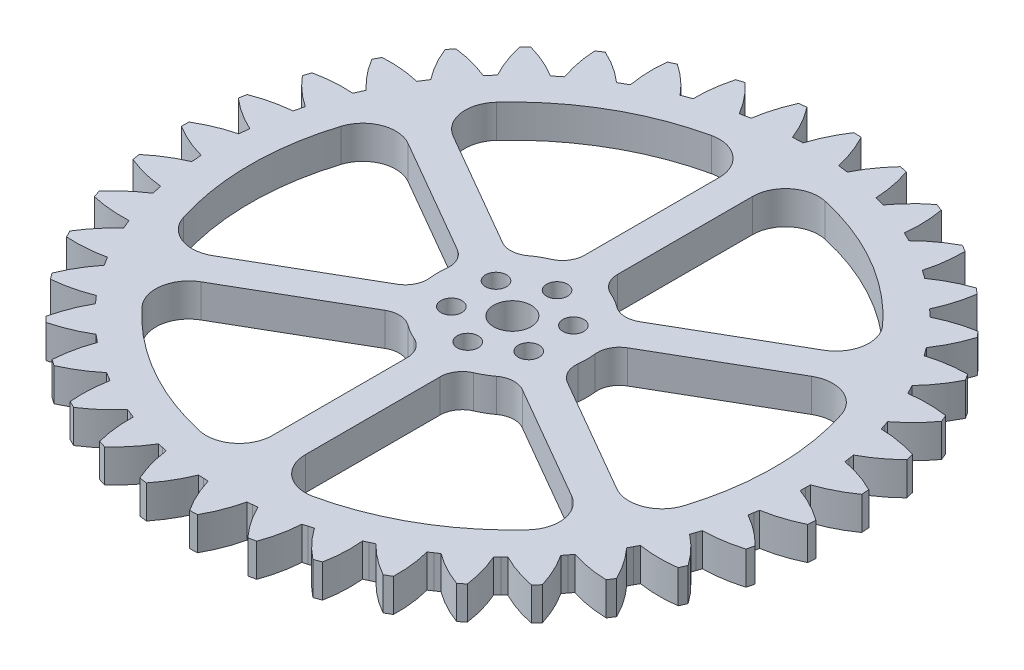
from build123d import *

# Parameters (mm, degrees)
BOSS_EXTRUDE1_DEPTH      = 1.5
CIRPATTERN2_COUNT        = 39
SKETCH3_R                = 0.95
SKETCH3_R_2              = 1.7
CUT_EXTRUDE1_DEPTH       = 43.388110201
CUT_EXTRUDE2_DEPTH       = 43.388110201
FILLET1_R                = 3
FILLET2_R                = 2
CIRPATTERN1_COUNT        = 6
FILLET1_OF_CIRPATTERN1_R = 3
FILLET2_OF_CIRPATTERN1_R = 2


with BuildPart() as part:
    # Sketch5 → Boss-Extrude1 (new, symmetric)
    with BuildSketch(Plane(origin=(0, 0, 0), x_dir=(1, 0, 0), z_dir=(0, 1, 0))):
        with BuildLine():
            Line((29.794725899, 2.521076439), (29.819813733, 2.177516055))
            Line((29.819813733, 2.177516055), (29.844901148, 1.833955641))
            ThreePointArc((29.844901148, 1.833955641), (28.363282087, 0.932985765), (26.768092937, 0.253049491))
            Line((26.768092937, 0.253049491), (26.763647744, -0.205029062))
            Line((26.763647744, -0.205029062), (0, 0))
            Line((0, 0), (26.449954509, 4.090817025))
            Line((26.449954509, 4.090817025), (26.520897753, 3.638243521))
            ThreePointArc((26.520897753, 3.638243521), (28.197939687, 3.197253599), (29.794725899, 2.521076439))
        make_face()
    boss_extrude1 = extrude(amount=BOSS_EXTRUDE1_DEPTH, both=True)

    # CirPattern2: Boss-Extrude1 ×39 about axis
    cirpattern2_axis = Axis((0, -1.5, 0), (0, 1, 0))
    for i in range(1, CIRPATTERN2_COUNT):
        add(boss_extrude1.rotate(cirpattern2_axis, i * 360 / CIRPATTERN2_COUNT))

    # Sketch3 → Cut-Extrude1 (cut, through all)
    with BuildSketch(Plane(origin=(0, 1.5, 0), x_dir=(1, 0, 0), z_dir=(0, 1, 0))):
        with Locations((-3.507402885, 2.025)):
            Circle(SKETCH3_R)
        with Locations((-3.507402885, -2.025)):
            Circle(SKETCH3_R)
        with Locations((0, -4.05)):
            Circle(SKETCH3_R)
        with Locations((3.507402885, -2.025)):
            Circle(SKETCH3_R)
        with Locations((3.507402885, 2.025)):
            Circle(SKETCH3_R)
        with Locations((0, 4.05)):
            Circle(SKETCH3_R)
        Circle(SKETCH3_R_2)
    extrude(amount=-CUT_EXTRUDE1_DEPTH, mode=Mode.SUBTRACT)

    # Sketch4 → Cut-Extrude2 (cut, through all)
    with BuildSketch(Plane(origin=(0, 1.5, 0), x_dir=(1, 0, 0), z_dir=(0, 1, 0))):
        with BuildLine():
            Line((6.470380585, 2.003625165), (21.289565422, 10.55948552))
            ThreePointArc((21.289565422, 10.55948552), (23.764434147, 0), (21.289565422, -10.55948552))
            Line((21.289565422, -10.55948552), (6.470380585, -2.003625165))
            ThreePointArc((6.470380585, -2.003625165), (6.773502692, 0), (6.470380585, 2.003625165))
        make_face()
    cut_extrude2 = extrude(amount=-CUT_EXTRUDE2_DEPTH, mode=Mode.SUBTRACT)

    # Fillet1
    fillet1_edges = [part.edges().sort_by_distance(p)[0] for p in [
        (21.289565422, 0, 10.55948552),
        (21.289565422, 0, -10.55948552),
    ]]
    fillet(fillet1_edges, radius=FILLET1_R)

    # Fillet2
    fillet2_edges = [part.edges().sort_by_distance(p)[0] for p in [
        (6.470380585, 0, 2.003625165),
        (6.470380585, 0, -2.003625165),
    ]]
    fillet(fillet2_edges, radius=FILLET2_R)

    # CirPattern1: Cut-Extrude2 ×6 about axis
    cirpattern1_axis = Axis((0, -1.5, 0), (0, 1, 0))
    for i in range(1, CIRPATTERN1_COUNT):
        add(cut_extrude2.rotate(cirpattern1_axis, i * 360 / CIRPATTERN1_COUNT), mode=Mode.SUBTRACT)

    # Fillet1 of CirPattern1
    fillet1_of_cirpattern1_edges = [part.edges().sort_by_distance(p)[0] for p in [
        (19.789565422, 0, -13.157561731),
        (1.5, 0, -23.717047251),
        (-1.5, 0, -23.717047251),
        (-19.789565422, 0, -13.157561731),
        (-21.289565422, 0, -10.55948552),
        (-21.289565422, 0, 10.55948552),
        (-19.789565422, 0, 13.157561731),
        (-1.5, 0, 23.717047251),
        (1.5, 0, 23.717047251),
        (19.789565422, 0, 13.157561731),
    ]]
    fillet(fillet1_of_cirpattern1_edges, radius=FILLET1_OF_CIRPATTERN1_R)

    # Fillet2 of CirPattern1
    fillet2_of_cirpattern1_edges = [part.edges().sort_by_distance(p)[0] for p in [
        (4.970380585, 0, -4.601701376),
        (1.5, 0, -6.605326541),
        (-1.5, 0, -6.605326541),
        (-4.970380585, 0, -4.601701376),
        (-6.470380585, 0, -2.003625165),
        (-6.470380585, 0, 2.003625165),
        (-4.970380585, 0, 4.601701376),
        (-1.5, 0, 6.605326541),
        (1.5, 0, 6.605326541),
        (4.970380585, 0, 4.601701376),
    ]]
    fillet(fillet2_of_cirpattern1_edges, radius=FILLET2_OF_CIRPATTERN1_R)


solid = part.part
